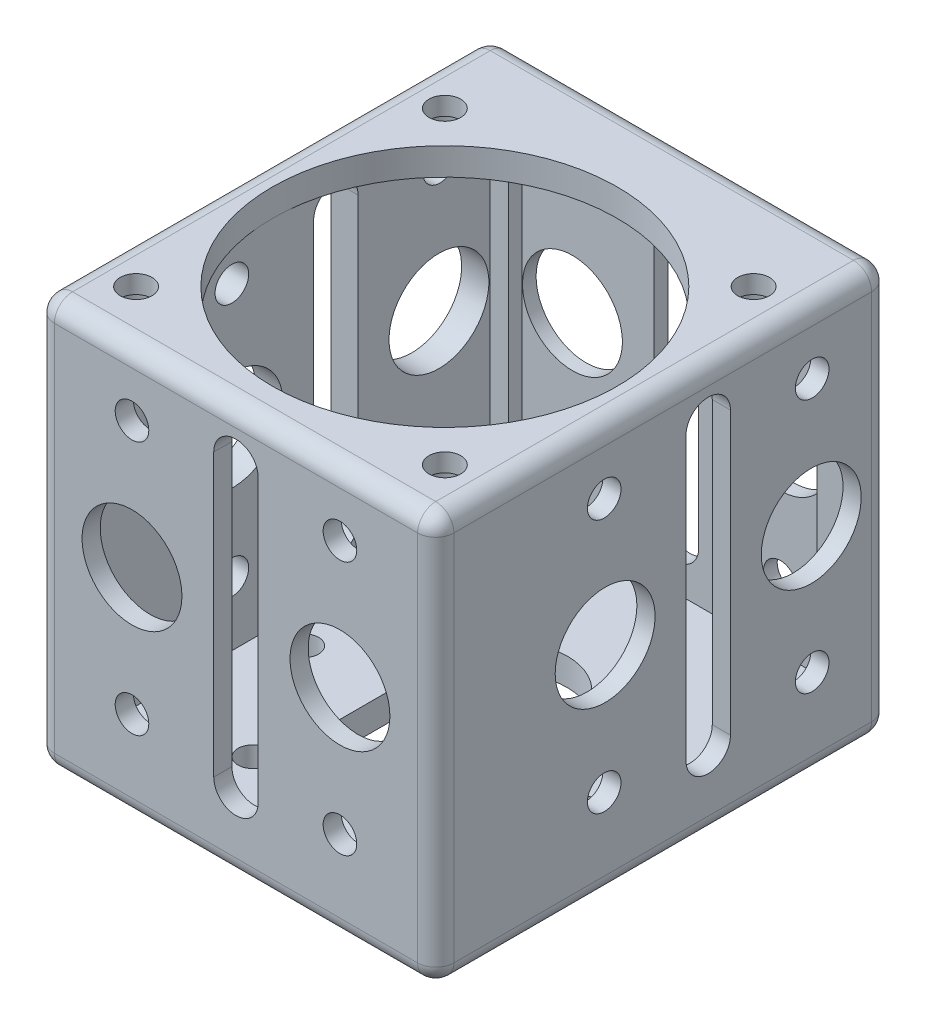
from build123d import *
from build123d.topology import SkipClean

# Parameters (mm, degrees)
SKETCH_1_W                = 40
SKETCH_1_H                = 40
SKETCH_1_R                = 1.55
EXTRUDE_2_DEPTH           = 3
CUT_EXTRUDE_1_DEPTH       = 1.5
SKETCH_2_W                = 3
SKETCH_2_H                = 3
EXTRUDE_7_DEPTH           = 45
SKETCH_5_W                = 40
SKETCH_5_H                = 3
EXTRUDE_8_DEPTH           = 40
SKETCH_6_R                = 12.5
CUT_EXTRUDE_2_DEPTH       = 4
CUT_EXTRUDE_START         = -4
CUT_EXTRUDE_3_DEPTH       = 4
SKETCH_8_R                = 5
CUT_EXTRUDE_4_DEPTH       = 4
SKETCH_9_R                = 2.5
CUT_EXTRUDE_5_DEPTH       = 4
SKETCH_10_W               = 1.5
SKETCH_10_H               = 34
SKETCH_10_W_2             = 34
SKETCH_10_H_2             = 1.5
EXTRUDE_10_DEPTH          = 45
CUT_EXTRUDE_12_DEPTH      = 63.507999488
CUT_EXTRUDE_12_DEPTH_BACK = 4
CUT_EXTRUDE_13_DEPTH      = 4
CUT_EXTRUDE_13_DEPTH_BACK = 64.442887702
CUT_EXTRUDE_15_DEPTH      = 10
CUT_EXTRUDE_15_DEPTH_BACK = 64.442887702
SKETCH_24_5_R             = 1.85
SKETCH_24_5_R_2           = 5.5
CUT_EXTRUDE_16_DEPTH      = 10
CUT_EXTRUDE_16_DEPTH_BACK = 64.442887702
SKETCH_25_R               = 5.5
SKETCH_25_R_2             = 1.85
SKETCH_27_R               = 5
SKETCH_27_R_2             = 1.55
EXTRUDE_11_DEPTH          = 3
SKETCH_31_W               = 40
SKETCH_31_H               = 48
EXTRUDE_12_DEPTH          = 20
SKETCH_32_W               = 40
SKETCH_32_H               = 58.5
EXTRUDE_13_DEPTH          = 3
CUT_EXTRUDE_START_2       = -3
SKETCH_33_R               = 4
SKETCH_33_R_2             = 1.6
CUT_EXTRUDE_17_DEPTH      = 3
SKETCH_34_R               = 19
CUT_EXTRUDE_18_DEPTH      = 3
CUT_EXTRUDE_START_3       = -42
SKETCH_35_R               = 19
CUT_EXTRUDE_20_DEPTH      = 42
SKETCH_36_W               = 40
SKETCH_36_H               = 48
CUT_EXTRUDE_21_DEPTH      = 10.5
SKETCH_39_R               = 1.5
CUT_EXTRUDE_22_DEPTH      = 3
SKETCH_44_W               = 48
SKETCH_44_H               = 48
EXTRUDE_17_DEPTH          = 2
SKETCH_45_W               = 48
SKETCH_45_H               = 48
EXTRUDE_18_DEPTH          = 2
SKETCH_46_W               = 42
SKETCH_46_H               = 42
CUT_EXTRUDE_23_DEPTH      = 2
CUT_EXTRUDE_28_DEPTH      = 2
CUT_EXTRUDE_28_DEPTH_BACK = 68.623960317
SKETCH_51_W               = 42
SKETCH_51_H               = 42
SKETCH_53_W               = 42
SKETCH_53_H               = 42
EXTRUDE_19_DEPTH          = 3
CUT_EXTRUDE_30_DEPTH      = 68.623960251
CUT_EXTRUDE_30_DEPTH_BACK = 68.623960251
SKETCH_56_R               = 5.5
SKETCH_56_R_2             = 1.85
SKETCH_56_R_3             = 2.45
SKETCH_60_W               = 38
SKETCH_60_H               = 36
CUT_EXTRUDE_32_DEPTH      = 42
SKETCH_61_W               = 44
SKETCH_61_H               = 48
EXTRUDE_20_DEPTH          = 2
SKETCH_62_W               = 38
SKETCH_62_H               = 42
CUT_EXTRUDE_33_DEPTH      = 20
SKETCH_63_R               = 1.85
SKETCH_63_R_2             = 5.5
CUT_EXTRUDE_34_DEPTH      = 3
SKETCH_64_R               = 2.45
CUT_EXTRUDE_35_DEPTH      = 3
SKETCH_67_W               = 44
SKETCH_67_H               = 50
SKETCH_67_R               = 1.5
SKETCH_67_R_2             = 19
EXTRUDE_21_DEPTH          = 6
SKETCH_68_W               = 44
SKETCH_68_H               = 50
CUT_EXTRUDE_36_DEPTH      = 3
SKETCH_71_R               = 2.5
CUT_EXTRUDE_41_DEPTH      = 1
SKETCH_72_R               = 1.75
CUT_EXTRUDE_42_DEPTH      = 3
CUT_EXTRUDE_START_4       = -2
SKETCH_73_R               = 2.5
CUT_EXTRUDE_43_DEPTH      = 2
FILLET_6_R                = 2
FILLET_7_R                = 2
FILLET_8_R                = 2
FILLET_9_R                = 2
FILLET_10_R               = 2


with BuildPart() as part:
    # 草图1 → 凸台-拉伸2 (new body)
    with BuildSketch(Plane(origin=(0, 0, 0), x_dir=(1, 0, 0), z_dir=(0, 1, 0))):
        Rectangle(SKETCH_1_W, SKETCH_1_H)
        with Locations(Location((0, 8.5, 0), (0, 0, 270))):
            Circle(SKETCH_1_R, mode=Mode.SUBTRACT)
        with Locations(Location((8.5, 0, 0), (0, 0, 270))):
            Circle(SKETCH_1_R, mode=Mode.SUBTRACT)
        with Locations(Location((0, -8.5, 0), (0, 0, 270))):
            Circle(SKETCH_1_R, mode=Mode.SUBTRACT)
        with Locations(Location((-8.5, 0, 0), (0, 0, 270))):
            Circle(SKETCH_1_R, mode=Mode.SUBTRACT)
    extrude(amount=-EXTRUDE_2_DEPTH)

    # 草图1<6> → 切除-拉伸1 (cut)
    with BuildSketch(Plane(origin=(0, 0, 0), x_dir=(1, 0, 0), z_dir=(0, 1, 0))):
        with BuildLine():
            ThreePointArc((4, 0), (2.828427125, 2.828427125), (0, 4))
            Line((0, 4), (0, -4))
            ThreePointArc((0, -4), (2.828427125, -2.828427125), (4, 0))
        make_face()
        with BuildLine():
            Line((0, -4), (0, 4))
            ThreePointArc((0, 4), (-4, 0), (0, -4))
        make_face()
    extrude(amount=-CUT_EXTRUDE_1_DEPTH, mode=Mode.SUBTRACT)

    # 草图2 → 凸台-拉伸7 (add)
    with BuildSketch(Plane(origin=(0, 0, 0), x_dir=(1, 0, 0), z_dir=(0, 1, 0))):
        with Locations((-18.5, 18.5)):
            Rectangle(SKETCH_2_W, SKETCH_2_H)
        with Locations((18.5, 18.5)):
            Rectangle(SKETCH_2_W, SKETCH_2_H)
        with Locations((18.5, -18.5)):
            Rectangle(SKETCH_2_W, SKETCH_2_H)
        with Locations((-18.5, -18.5)):
            Rectangle(SKETCH_2_W, SKETCH_2_H)
    extrude(amount=EXTRUDE_7_DEPTH)

    # 草图5 → 凸台-拉伸8 (add)
    with BuildSketch(Plane.ZY.offset(20)):
        with Locations((0, 43.5)):
            Rectangle(SKETCH_5_W, SKETCH_5_H)
    extrude(amount=-EXTRUDE_8_DEPTH)

    # 草图6 → 切除-拉伸2 (cut)
    with BuildSketch(Plane(origin=(0, 45, 0), x_dir=(1, 0, 0), z_dir=(0, 1, 0))):
        with Locations(Location((0, 0, 0), (0, 0, 270))):
            Circle(SKETCH_6_R)
    extrude(amount=-CUT_EXTRUDE_2_DEPTH, mode=Mode.SUBTRACT)

    # 草图7 → 切除-拉伸3 (cut)
    with SkipClean():  # the faces are left unmerged after this step: merging them gives an invalid solid
        with BuildSketch(Plane.XZ.offset(3).offset(CUT_EXTRUDE_START)):
            with BuildLine():
                ThreePointArc((-4, 0), (-2.828427125, -2.828427125), (0, -4))
                Line((0, -4), (0, 0))
                Line((0, 0), (-4, 0))
            make_face()
            with BuildLine():
                Line((0, 0), (0, -4))
                ThreePointArc((0, -4), (2.828427125, -2.828427125), (4, 0))
                ThreePointArc((4, 0), (0, 4), (-4, 0))
                Line((-4, 0), (0, 0))
            make_face()
        extrude(amount=CUT_EXTRUDE_3_DEPTH, mode=Mode.SUBTRACT)

    # 草图8 → 切除-拉伸4 (cut)
    with SkipClean():  # the faces are left unmerged after this step: merging them gives an invalid solid
        with BuildSketch(Plane.XZ.offset(3)):
            with Locations(Location((-12, 12, 0), (0, 0, 270))):
                Circle(SKETCH_8_R)
            with Locations(Location((12, 12, 0), (0, 0, 270))):
                Circle(SKETCH_8_R)
            with Locations(Location((12, -12, 0), (0, 0, 270))):
                Circle(SKETCH_8_R)
            with Locations(Location((-12, -12, 0), (0, 0, 270))):
                Circle(SKETCH_8_R)
        extrude(amount=-CUT_EXTRUDE_4_DEPTH, mode=Mode.SUBTRACT)

    # 草图9 → 切除-拉伸5 (cut)
    with SkipClean():  # the faces are left unmerged after this step: merging them gives an invalid solid
        with BuildSketch(Plane(origin=(0, 45, 0), x_dir=(1, 0, 0), z_dir=(0, 1, 0))):
            with Locations(Location((-12.727922061, 12.727922061, 0), (0, 0, 270))):
                Circle(SKETCH_9_R)
            with Locations(Location((12.727922061, 12.727922061, 0), (0, 0, 270))):
                Circle(SKETCH_9_R)
            with Locations(Location((12.727922061, -12.727922061, 0), (0, 0, 270))):
                Circle(SKETCH_9_R)
            with Locations(Location((-12.727922061, -12.727922061, 0), (0, 0, 270))):
                Circle(SKETCH_9_R)
        extrude(amount=-CUT_EXTRUDE_5_DEPTH, mode=Mode.SUBTRACT)

    # 草图10 → 凸台-拉伸10 (add)
    with SkipClean():  # the faces are left unmerged after this step: merging them gives an invalid solid
        with BuildSketch(Plane(origin=(0, 0, 0), x_dir=(1, 0, 0), z_dir=(0, 1, 0))):
            with Locations((19.25, 0)):
                Rectangle(SKETCH_10_W, SKETCH_10_H)
            with Locations((0, -19.25)):
                Rectangle(SKETCH_10_W_2, SKETCH_10_H_2)
            with Locations((-19.25, 0)):
                Rectangle(SKETCH_10_W, SKETCH_10_H)
            with Locations((0, 19.25)):
                Rectangle(SKETCH_10_W_2, SKETCH_10_H_2)
        extrude(amount=EXTRUDE_10_DEPTH)

    # 草图20 → 切除-拉伸12 (cut, two sides: drawn at the far end of the back side and taken through both)
    with SkipClean():  # the faces are left unmerged after this step: merging them gives an invalid solid
        with BuildSketch(Plane(origin=(0, 0, 18.5), x_dir=(-1, 0, 0), z_dir=(0, 0, -1)).offset(-CUT_EXTRUDE_12_DEPTH_BACK)):
            with BuildLine():
                Line((-2.45, 36.5), (-2.45, 5.5))
                ThreePointArc((-2.45, 5.5), (0, 3.05), (2.45, 5.5))
                Line((2.45, 5.5), (2.45, 36.5))
                ThreePointArc((2.45, 36.5), (0, 38.95), (-2.45, 36.5))
            make_face()
        extrude(amount=CUT_EXTRUDE_12_DEPTH + CUT_EXTRUDE_12_DEPTH_BACK, mode=Mode.SUBTRACT)

    # 草图24 → 切除-拉伸13 (cut, two sides: drawn at the far end of the back side and taken through both)
    with SkipClean():  # the faces are left unmerged after this step: merging them gives an invalid solid
        with BuildSketch(Plane(origin=(20, 0, 0), x_dir=(0, 0, -1), z_dir=(1, 0, 0)).offset(-CUT_EXTRUDE_13_DEPTH_BACK)):
            with BuildLine():
                Line((-2.45, 36.5), (-2.45, 5.5))
                ThreePointArc((-2.45, 5.5), (0, 3.05), (2.45, 5.5))
                Line((2.45, 5.5), (2.45, 36.5))
                ThreePointArc((2.45, 36.5), (0, 38.95), (-2.45, 36.5))
            make_face()
        extrude(amount=CUT_EXTRUDE_13_DEPTH + CUT_EXTRUDE_13_DEPTH_BACK, mode=Mode.SUBTRACT)

    # 草图24<5> → 切除-拉伸15 (cut, two sides: drawn at the far end of the back side and taken through both)
    with SkipClean():  # the faces are left unmerged after this step: merging them gives an invalid solid
        with BuildSketch(Plane(origin=(20, 0, 0), x_dir=(0, 0, -1), z_dir=(1, 0, 0)).offset(-CUT_EXTRUDE_15_DEPTH_BACK)):
            with Locations((-11.45, 35)):
                Circle(SKETCH_24_5_R)
            with Locations(Location((-11.45, 7, 0), (0, 0, 180))):
                Circle(SKETCH_24_5_R)
            with Locations((11.45, 7)):
                Circle(SKETCH_24_5_R)
            with Locations(Location((11.45, 35, 0), (0, 0, 180))):
                Circle(SKETCH_24_5_R)
            with Locations((-11.35, 21)):
                Circle(SKETCH_24_5_R_2)
            with Locations(Location((11.35, 21, 0), (0, 0, 180))):
                Circle(SKETCH_24_5_R_2)
        extrude(amount=CUT_EXTRUDE_15_DEPTH + CUT_EXTRUDE_15_DEPTH_BACK, mode=Mode.SUBTRACT)

    # 草图25 → 切除-拉伸16 (cut, two sides: drawn at the far end of the back side and taken through both)
    with SkipClean():  # the faces are left unmerged after this step: merging them gives an invalid solid
        with BuildSketch(Plane(origin=(0, 0, -20), x_dir=(-1, 0, 0), z_dir=(0, 0, -1)).offset(-CUT_EXTRUDE_16_DEPTH_BACK)):
            with Locations((-11.45, 21)):
                Circle(SKETCH_25_R)
            with Locations((11.45, 21)):
                Circle(SKETCH_25_R)
            with Locations((-11.45, 35)):
                Circle(SKETCH_25_R_2)
            with Locations((-11.45, 7)):
                Circle(SKETCH_25_R_2)
            with Locations((11.45, 7)):
                Circle(SKETCH_25_R_2)
            with Locations((11.45, 35)):
                Circle(SKETCH_25_R_2)
        extrude(amount=CUT_EXTRUDE_16_DEPTH + CUT_EXTRUDE_16_DEPTH_BACK, mode=Mode.SUBTRACT)

    # 草图27 → 凸台-拉伸11 (add)
    with SkipClean():  # the faces are left unmerged after this step: merging them gives an invalid solid
        with BuildSketch(Plane.XZ.offset(3)):
            with Locations((-12, 12)):
                Circle(SKETCH_27_R)
            with Locations((12, 12)):
                Circle(SKETCH_27_R)
            with Locations((12, -12)):
                Circle(SKETCH_27_R)
            with Locations((-12, -12)):
                Circle(SKETCH_27_R)
            with Locations((0, -8.5)):
                Circle(SKETCH_27_R_2)
            with Locations((8.5, 0)):
                Circle(SKETCH_27_R_2)
            with Locations((0, 8.5)):
                Circle(SKETCH_27_R_2)
            with Locations((-8.5, 0)):
                Circle(SKETCH_27_R_2)
        extrude(amount=-EXTRUDE_11_DEPTH)

    # 草图31 → 凸台-拉伸12 (add)
    with SkipClean():  # the faces are left unmerged after this step: merging them gives an invalid solid
        with BuildSketch(Plane(origin=(0, 0, 18.5), x_dir=(-1, 0, 0), z_dir=(0, 0, -1))):
            with Locations((0, 21)):
                Rectangle(SKETCH_31_W, SKETCH_31_H)
        extrude(amount=-EXTRUDE_12_DEPTH)

    # 草图32 → 凸台-拉伸13 (add)
    with SkipClean():  # the faces are left unmerged after this step: merging them gives an invalid solid
        with BuildSketch(Plane(origin=(0, 45, 0), x_dir=(1, 0, 0), z_dir=(0, 1, 0))):
            with Locations((0, -9.25)):
                Rectangle(SKETCH_32_W, SKETCH_32_H)
        extrude(amount=-EXTRUDE_13_DEPTH)

    # 草图33 → 切除-拉伸17 (cut)
    # profile 1 of 7: a face of its own
    with BuildSketch(Plane.XZ.offset(3).offset(CUT_EXTRUDE_START_2)):
        with BuildLine():
            ThreePointArc((-6.5, 0), (0, -6.5), (6.5, 0))
            Line((6.5, 0), (6.5, 14))
            ThreePointArc((6.5, 14), (0, 20.5), (-6.5, 14))
            Line((-6.5, 14), (-6.5, 0))
        make_face()
        Circle(SKETCH_33_R, mode=Mode.SUBTRACT)
    # profile 2 of 7: a face of its own
    with BuildSketch(Plane.XZ.offset(3).offset(CUT_EXTRUDE_START_2)):
        with Locations(Location((-7.75, 20.423393759, 0), (0, 0, 270))):
            Circle(SKETCH_33_R_2)
    # profile 3 of 7: a face of its own
    with BuildSketch(Plane.XZ.offset(3).offset(CUT_EXTRUDE_START_2)):
        with Locations(Location((7.75, 20.423393759, 0), (0, 0, 270))):
            Circle(SKETCH_33_R_2)
    # profile 4 of 7: a face of its own
    with BuildSketch(Plane.XZ.offset(3).offset(CUT_EXTRUDE_START_2)):
        with Locations(Location((-15.5, 7, 0), (0, 0, 270))):
            Circle(SKETCH_33_R_2)
    # profile 5 of 7: a face of its own
    with BuildSketch(Plane.XZ.offset(3).offset(CUT_EXTRUDE_START_2)):
        with Locations(Location((15.5, 7, 0), (0, 0, 270))):
            Circle(SKETCH_33_R_2)
    # profile 6 of 7: a face of its own
    with BuildSketch(Plane.XZ.offset(3).offset(CUT_EXTRUDE_START_2)):
        with Locations(Location((-7.75, -6.423393759, 0), (0, 0, 270))):
            Circle(SKETCH_33_R_2)
    # profile 7 of 7: a face of its own
    with BuildSketch(Plane.XZ.offset(3).offset(CUT_EXTRUDE_START_2)):
        with Locations(Location((7.75, -6.423393759, 0), (0, 0, 270))):
            Circle(SKETCH_33_R_2)
    extrude(amount=CUT_EXTRUDE_17_DEPTH, mode=Mode.SUBTRACT)

    # 草图34 → 切除-拉伸18 (cut)
    with BuildSketch(Plane.XZ.offset(-42)):
        with Locations(Location((0, 7, 0), (0, 0, 270))):
            Circle(SKETCH_34_R)
    extrude(amount=-CUT_EXTRUDE_18_DEPTH, mode=Mode.SUBTRACT)

    # 草图35 → 切除-拉伸20 (cut)
    with BuildSketch(Plane(origin=(0, 42, 0), x_dir=(1, 0, 0), z_dir=(0, 1, 0)).offset(CUT_EXTRUDE_START_3)):
        with Locations(Location((0, -7, 0), (0, 0, 90))):
            Circle(SKETCH_35_R)
    extrude(amount=CUT_EXTRUDE_20_DEPTH, mode=Mode.SUBTRACT)

    # 草图36 → 切除-拉伸21 (cut)
    with BuildSketch(Plane.XY.offset(38.5)):
        with Locations((0, 21)):
            Rectangle(SKETCH_36_W, SKETCH_36_H)
    extrude(amount=-CUT_EXTRUDE_21_DEPTH, mode=Mode.SUBTRACT)

    # 草图39 → 切除-拉伸22 (cut)
    with BuildSketch(Plane(origin=(0, 45, 0), x_dir=(1, 0, 0), z_dir=(0, 1, 0))):
        with Locations(Location((-17, 10, 0), (0, 0, 270))):
            Circle(SKETCH_39_R)
        with Locations(Location((17, 10, 0), (0, 0, 270))):
            Circle(SKETCH_39_R)
        with Locations(Location((-17, -24, 0), (0, 0, 270))):
            Circle(SKETCH_39_R)
        with Locations(Location((17, -24, 0), (0, 0, 270))):
            Circle(SKETCH_39_R)
    extrude(amount=-CUT_EXTRUDE_22_DEPTH, mode=Mode.SUBTRACT)

    # 草图44 → 凸台-拉伸17 (add)
    with BuildSketch(Plane.ZY.offset(20)):
        with Locations((4, 21)):
            Rectangle(SKETCH_44_W, SKETCH_44_H)
    extrude(amount=EXTRUDE_17_DEPTH)

    # 草图45 → 凸台-拉伸18 (add)
    with BuildSketch(Plane(origin=(20, 0, 0), x_dir=(0, 0, -1), z_dir=(1, 0, 0))):
        with Locations((-4, 21)):
            Rectangle(SKETCH_45_W, SKETCH_45_H)
    extrude(amount=EXTRUDE_18_DEPTH)

    # 草图46 → 切除-拉伸23 (cut)
    with BuildSketch(Plane.ZY.offset(-20)):
        with Locations((4, 21)):
            Rectangle(SKETCH_46_W, SKETCH_46_H)
    extrude(amount=CUT_EXTRUDE_23_DEPTH, mode=Mode.SUBTRACT)

    # 草图51 → 切除-拉伸28 (cut, two sides: drawn at the far end of the back side and taken through both)
    with BuildSketch(Plane(origin=(-20, 0, 0), x_dir=(0, 0, -1), z_dir=(1, 0, 0)).offset(-CUT_EXTRUDE_28_DEPTH_BACK)):
        with Locations((-4, 21)):
            Rectangle(SKETCH_51_W, SKETCH_51_H)
    extrude(amount=CUT_EXTRUDE_28_DEPTH + CUT_EXTRUDE_28_DEPTH_BACK, mode=Mode.SUBTRACT)

    # 草图53 → 凸台-拉伸19 (add)
    with BuildSketch(Plane.ZY.offset(22)):
        with Locations((4, 21)):
            Rectangle(SKETCH_53_W, SKETCH_53_H)
    extrude(amount=-EXTRUDE_19_DEPTH)

    # 草图56 → 切除-拉伸30 (cut, two sides: drawn at the far end of the back side and taken through both)
    with BuildSketch(Plane.ZY.offset(-20).offset(-CUT_EXTRUDE_30_DEPTH_BACK)):
        with Locations((-11.35, 21)):
            Circle(SKETCH_56_R)
        with Locations((-11.45, 35)):
            Circle(SKETCH_56_R_2)
        with Locations((-11.45, 7)):
            Circle(SKETCH_56_R_2)
        with Locations((0, 5.5)):
            Circle(SKETCH_56_R_3)
        with BuildLine():
            ThreePointArc((2.45, 36.5), (0, 34.05), (-2.45, 36.5))
            Line((-2.45, 36.5), (-2.45, 5.5))
            ThreePointArc((-2.45, 5.5), (0, 7.95), (2.45, 5.5))
            Line((2.45, 5.5), (2.45, 36.5))
        make_face()
        with Locations((0, 36.5)):
            Circle(SKETCH_56_R_3)
        with Locations((11.35, 21)):
            Circle(SKETCH_56_R)
        with Locations((11.45, 7)):
            Circle(SKETCH_56_R_2)
        with Locations((11.45, 35)):
            Circle(SKETCH_56_R_2)
    extrude(amount=CUT_EXTRUDE_30_DEPTH + CUT_EXTRUDE_30_DEPTH_BACK, mode=Mode.SUBTRACT)

    # 草图60 → 切除-拉伸32 (cut)
    with BuildSketch(Plane(origin=(0, 0, 0), x_dir=(1, 0, 0), z_dir=(0, 1, 0))):
        with Locations((0, -7)):
            Rectangle(SKETCH_60_W, SKETCH_60_H)
    extrude(amount=CUT_EXTRUDE_32_DEPTH, mode=Mode.SUBTRACT)

    # 草图61 → 凸台-拉伸20 (add)
    with BuildSketch(Plane.XY.offset(28)):
        with Locations((0, 21)):
            Rectangle(SKETCH_61_W, SKETCH_61_H)
    extrude(amount=EXTRUDE_20_DEPTH)

    # 草图62 → 切除-拉伸33 (cut)
    with BuildSketch(Plane.XY.offset(28)):
        with Locations((0, 21)):
            Rectangle(SKETCH_62_W, SKETCH_62_H)
    extrude(amount=-CUT_EXTRUDE_33_DEPTH, mode=Mode.SUBTRACT)

    # 草图63 → 切除-拉伸34 (cut)
    with BuildSketch(Plane.XY.offset(30).offset(CUT_EXTRUDE_START_2)):
        with Locations(Location((-11.45, 35, 0), (0, 0, 180))):
            Circle(SKETCH_63_R)
        with Locations(Location((-11.45, 21, 0), (0, 0, 180))):
            Circle(SKETCH_63_R_2)
        with Locations(Location((-11.45, 7, 0), (0, 0, 180))):
            Circle(SKETCH_63_R)
        with Locations(Location((11.45, 7, 0), (0, 0, 180))):
            Circle(SKETCH_63_R)
        with Locations(Location((11.45, 21, 0), (0, 0, 180))):
            Circle(SKETCH_63_R_2)
        with Locations(Location((11.45, 35, 0), (0, 0, 180))):
            Circle(SKETCH_63_R)
    extrude(amount=CUT_EXTRUDE_34_DEPTH, mode=Mode.SUBTRACT)

    # 草图64 → 切除-拉伸35 (cut)
    with BuildSketch(Plane.XY.offset(30)):
        with BuildLine():
            ThreePointArc((2.45, 36.5), (0, 34.05), (-2.45, 36.5))
            Line((-2.45, 36.5), (-2.45, 5.5))
            ThreePointArc((-2.45, 5.5), (0, 7.95), (2.45, 5.5))
            Line((2.45, 5.5), (2.45, 36.5))
        make_face()
        with Locations((0, 36.5)):
            Circle(SKETCH_64_R)
        with Locations((0, 5.5)):
            Circle(SKETCH_64_R)
    extrude(amount=-CUT_EXTRUDE_35_DEPTH, mode=Mode.SUBTRACT)

    # 草图67 → 凸台-拉伸21 (add)
    with BuildSketch(Plane(origin=(0, 45, 0), x_dir=(1, 0, 0), z_dir=(0, 1, 0))):
        with Locations((0, -5)):
            Rectangle(SKETCH_67_W, SKETCH_67_H)
        with Locations(Location((-17, 10, 0), (0, 0, 270))):
            Circle(SKETCH_67_R, mode=Mode.SUBTRACT)
        with Locations(Location((17, 10, 0), (0, 0, 270))):
            Circle(SKETCH_67_R, mode=Mode.SUBTRACT)
        with Locations(Location((17, -24, 0), (0, 0, 270))):
            Circle(SKETCH_67_R, mode=Mode.SUBTRACT)
        with Locations(Location((-17, -24, 0), (0, 0, 270))):
            Circle(SKETCH_67_R, mode=Mode.SUBTRACT)
        with Locations(Location((0, -7, 0), (0, 0, 90))):
            Circle(SKETCH_67_R_2, mode=Mode.SUBTRACT)
    extrude(amount=-EXTRUDE_21_DEPTH)

    # 草图68 → 切除-拉伸36 (cut)
    with BuildSketch(Plane(origin=(0, 45, 0), x_dir=(1, 0, 0), z_dir=(0, 1, 0))):
        with Locations((0, -5)):
            Rectangle(SKETCH_68_W, SKETCH_68_H)
    extrude(amount=-CUT_EXTRUDE_36_DEPTH, mode=Mode.SUBTRACT)

    # 草图71 → 切除-拉伸41 (cut)
    with BuildSketch(Plane.XZ.offset(-39)):
        with Locations(Location((-17, 24, 0), (0, 0, 270))):
            Circle(SKETCH_71_R)
        with Locations(Location((17, 24, 0), (0, 0, 270))):
            Circle(SKETCH_71_R)
        with Locations(Location((17, -10, 0), (0, 0, 270))):
            Circle(SKETCH_71_R)
        with Locations(Location((-17, -10, 0), (0, 0, 270))):
            Circle(SKETCH_71_R)
    extrude(amount=-CUT_EXTRUDE_41_DEPTH, mode=Mode.SUBTRACT)

    # 草图72 → 切除-拉伸42 (cut)
    with BuildSketch(Plane(origin=(0, 42, 0), x_dir=(1, 0, 0), z_dir=(0, 1, 0))):
        with Locations(Location((-17, 10, 0), (0, 0, 270))):
            Circle(SKETCH_72_R)
        with Locations(Location((17, 10, 0), (0, 0, 270))):
            Circle(SKETCH_72_R)
        with Locations(Location((17, -24, 0), (0, 0, 270))):
            Circle(SKETCH_72_R)
        with Locations(Location((-17, -24, 0), (0, 0, 270))):
            Circle(SKETCH_72_R)
    extrude(amount=-CUT_EXTRUDE_42_DEPTH, mode=Mode.SUBTRACT)

    # 草图73 → 切除-拉伸43 (cut)
    with BuildSketch(Plane(origin=(0, 39, 0), x_dir=(1, 0, 0), z_dir=(0, 1, 0)).offset(CUT_EXTRUDE_START_4)):
        with Locations(Location((-17, -24, 0), (0, 0, 90))):
            Circle(SKETCH_73_R)
        with Locations(Location((-17, 10, 0), (0, 0, 90))):
            Circle(SKETCH_73_R)
    extrude(amount=CUT_EXTRUDE_43_DEPTH, mode=Mode.SUBTRACT)

    # 圆角6
    fillet_6_edges = [part.edges().sort_by_distance(p)[0] for p in [
        (-22, 42, 5),
        (0, 42, -20),
        (22, 42, 5),
        (0, 42, 30),
    ]]
    fillet(fillet_6_edges, radius=FILLET_6_R)

    # 圆角7
    # the kernel refuses this fillet: 2 mm, written as the material it takes off along each edge
    with BuildSketch(Plane(origin=(-20, 40, 28), x_dir=(0, 0, 1), z_dir=(-1, 0, 0))) as fillet_7_piece_1_section:
        Polygon((0, 0), (FILLET_7_R, 0), (FILLET_7_R, FILLET_7_R), (0, FILLET_7_R), align=None)
    fillet_7_piece_1 = extrude(amount=FILLET_7_R, mode=Mode.PRIVATE)
    fillet_7_piece_1 = fillet_7_piece_1 - Plane(origin=(-20, 40, 28), x_dir=(0, -0.7071067811865475, -0.7071067811865475), z_dir=(-1, 0, 0)) * Sphere(FILLET_7_R, mode=Mode.PRIVATE)
    add(fillet_7_piece_1, mode=Mode.SUBTRACT)
    with BuildSketch(Plane(origin=(20, 40, 28), x_dir=(0, 0, 1), z_dir=(1, 0, 0))) as fillet_7_piece_2_section:
        Polygon((0, 0), (FILLET_7_R, 0), (FILLET_7_R, -FILLET_7_R), (0, -FILLET_7_R), align=None)
    fillet_7_piece_2 = extrude(amount=FILLET_7_R, mode=Mode.PRIVATE)
    fillet_7_piece_2 = fillet_7_piece_2 - Plane(origin=(20, 40, 28), x_dir=(0, -0.7071067811865475, -0.7071067811865475), z_dir=(1, 0, 0)) * Sphere(FILLET_7_R, mode=Mode.PRIVATE)
    add(fillet_7_piece_2, mode=Mode.SUBTRACT)
    with BuildSketch(Plane(origin=(27, -3, 30), x_dir=(0, 0, -1), z_dir=(-1, 0, 0))) as fillet_7_piece_3:
        with BuildLine():
            CenterArc((FILLET_7_R, -FILLET_7_R), FILLET_7_R, 90, 90)
            Line((0, -FILLET_7_R), (0, 0))
            Line((0, 0), (FILLET_7_R, 0))
        make_face()
    extrude(amount=54, mode=Mode.SUBTRACT)
    with BuildSketch(Plane(origin=(22, 40, 30), x_dir=(0, 0, -1), z_dir=(0, -1, 0)), Plane(origin=(-22, -8, 30), x_dir=(0, 0, -1), z_dir=(0, 1, 0))) as fillet_7_piece_4:
        with BuildLine():
            CenterArc((FILLET_7_R, -FILLET_7_R), FILLET_7_R, 90, 90)
            Line((0, -FILLET_7_R), (0, 0))
            Line((0, 0), (FILLET_7_R, 0))
        make_face()
    extrude(amount=48, mode=Mode.SUBTRACT)

    # 圆角8
    # the kernel refuses this fillet: 2 mm, written as the material it takes off along each edge
    with BuildSketch(Plane(origin=(20, 40, -18), x_dir=(1, 0, 0), z_dir=(0, 0, -1))) as fillet_8_piece_1_section:
        Polygon((0, 0), (FILLET_8_R, 0), (FILLET_8_R, -FILLET_8_R), (0, -FILLET_8_R), align=None)
    fillet_8_piece_1 = extrude(amount=FILLET_8_R, mode=Mode.PRIVATE)
    fillet_8_piece_1 = fillet_8_piece_1 - Plane(origin=(20, 40, -18), x_dir=(-0.7071067811865475, -0.7071067811865475, 0), z_dir=(0, 0, -1)) * Sphere(FILLET_8_R, mode=Mode.PRIVATE)
    add(fillet_8_piece_1, mode=Mode.SUBTRACT)
    with BuildSketch(Plane(origin=(20, -1, 28), x_dir=(1, 0, 0), z_dir=(0, -1, 0))) as fillet_8_piece_2_section:
        Polygon((0, 0), (FILLET_8_R, 0), (FILLET_8_R, FILLET_8_R), (0, FILLET_8_R), align=None)
    fillet_8_piece_2 = extrude(amount=FILLET_8_R, mode=Mode.PRIVATE)
    fillet_8_piece_2 = fillet_8_piece_2 - Plane(origin=(20, -1, 28), x_dir=(-0.7071067811865476, 0, -0.7071067811865475), z_dir=(0, -1, 0)) * Sphere(FILLET_8_R, mode=Mode.PRIVATE)
    add(fillet_8_piece_2, mode=Mode.SUBTRACT)
    with BuildSketch(Plane(origin=(22, 40, -20), x_dir=(-1, 0, 0), z_dir=(0, -1, 0))) as fillet_8_piece_3:
        with BuildLine():
            CenterArc((FILLET_8_R, -FILLET_8_R), FILLET_8_R, 90, 90)
            Line((0, -FILLET_8_R), (0, 0))
            Line((0, 0), (FILLET_8_R, 0))
        make_face()
    extrude(amount=48, mode=Mode.SUBTRACT)
    with BuildSketch(Plane(origin=(22, -3, -25), x_dir=(-1, 0, 0), z_dir=(0, 0, 1))) as fillet_8_piece_4:
        with BuildLine():
            CenterArc((FILLET_8_R, -FILLET_8_R), FILLET_8_R, 90, 90)
            Line((0, -FILLET_8_R), (0, 0))
            Line((0, 0), (FILLET_8_R, 0))
        make_face()
    extrude(amount=53, mode=Mode.SUBTRACT)

    # 圆角9
    # the kernel refuses this fillet: 2 mm, written as the material it takes off along each edge
    with BuildSketch(Plane(origin=(-20, -1, 28), x_dir=(-1, 0, 0), z_dir=(0, -1, 0))) as fillet_9_piece_1_section:
        Polygon((0, 0), (FILLET_9_R, 0), (FILLET_9_R, -FILLET_9_R), (0, -FILLET_9_R), align=None)
    fillet_9_piece_1 = extrude(amount=FILLET_9_R, mode=Mode.PRIVATE)
    fillet_9_piece_1 = fillet_9_piece_1 - Plane(origin=(-20, -1, 28), x_dir=(0.7071067811865475, 0, -0.7071067811865475), z_dir=(0, -1, 0)) * Sphere(FILLET_9_R, mode=Mode.PRIVATE)
    add(fillet_9_piece_1, mode=Mode.SUBTRACT)
    with BuildSketch(Plane(origin=(20, -1, -18), x_dir=(0, -1, 0), z_dir=(0, 0, -1))) as fillet_9_piece_2_section:
        Polygon((0, 0), (FILLET_9_R, 0), (FILLET_9_R, -FILLET_9_R), (0, -FILLET_9_R), align=None)
    fillet_9_piece_2 = extrude(amount=FILLET_9_R, mode=Mode.PRIVATE)
    fillet_9_piece_2 = fillet_9_piece_2 - Plane(origin=(20, -1, -18), x_dir=(-0.7071067811865475, 0.7071067811865475, 0), z_dir=(0, 0, -1)) * Sphere(FILLET_9_R, mode=Mode.PRIVATE)
    add(fillet_9_piece_2, mode=Mode.SUBTRACT)
    with BuildSketch(Plane(origin=(-22, -3, 28), x_dir=(1, 0, 0), z_dir=(0, 0, -1))) as fillet_9_piece_3:
        with BuildLine():
            CenterArc((FILLET_9_R, -FILLET_9_R), FILLET_9_R, 90, 90)
            Line((0, -FILLET_9_R), (0, 0))
            Line((0, 0), (FILLET_9_R, 0))
        make_face()
    extrude(amount=53, mode=Mode.SUBTRACT)
    with BuildSketch(Plane(origin=(20, -3, -20), x_dir=(0, 1, 0), z_dir=(-1, 0, 0))) as fillet_9_piece_4:
        with BuildLine():
            CenterArc((FILLET_9_R, -FILLET_9_R), FILLET_9_R, 90, 90)
            Line((0, -FILLET_9_R), (0, 0))
            Line((0, 0), (FILLET_9_R, 0))
        make_face()
    extrude(amount=47, mode=Mode.SUBTRACT)

    # 圆角10
    # the kernel refuses this fillet: 2 mm, written as the material it takes off along each edge
    with BuildSketch(Plane(origin=(-20, 40, -18), x_dir=(-1, 0, 0), z_dir=(0, 0, -1))) as fillet_10_piece_1_section:
        Polygon((0, 0), (FILLET_10_R, 0), (FILLET_10_R, FILLET_10_R), (0, FILLET_10_R), align=None)
    fillet_10_piece_1 = extrude(amount=FILLET_10_R, mode=Mode.PRIVATE)
    fillet_10_piece_1 = fillet_10_piece_1 - Plane(origin=(-20, 40, -18), x_dir=(0.7071067811865475, -0.7071067811865475, 0), z_dir=(0, 0, -1)) * Sphere(FILLET_10_R, mode=Mode.PRIVATE)
    add(fillet_10_piece_1, mode=Mode.SUBTRACT)
    with BuildSketch(Plane(origin=(-20, -1, -18), x_dir=(-1, 0, 0), z_dir=(0, 0, -1))) as fillet_10_piece_2_section:
        Polygon((0, 0), (FILLET_10_R, 0), (FILLET_10_R, -FILLET_10_R), (0, -FILLET_10_R), align=None)
    fillet_10_piece_2 = extrude(amount=FILLET_10_R, mode=Mode.PRIVATE)
    fillet_10_piece_2 = fillet_10_piece_2 - Plane(origin=(-20, -1, -18), x_dir=(0.7071067811865475, 0.7071067811865475, 0), z_dir=(0, 0, -1)) * Sphere(FILLET_10_R, mode=Mode.PRIVATE)
    add(fillet_10_piece_2, mode=Mode.SUBTRACT)
    with BuildSketch(Plane(origin=(-22, -1, -20), x_dir=(1, 0, 0), z_dir=(0, 1, 0))) as fillet_10_piece_3:
        with BuildLine():
            CenterArc((FILLET_10_R, -FILLET_10_R), FILLET_10_R, 90, 90)
            Line((0, -FILLET_10_R), (0, 0))
            Line((0, 0), (FILLET_10_R, 0))
        make_face()
    extrude(amount=41, mode=Mode.SUBTRACT)


solid = part.part
